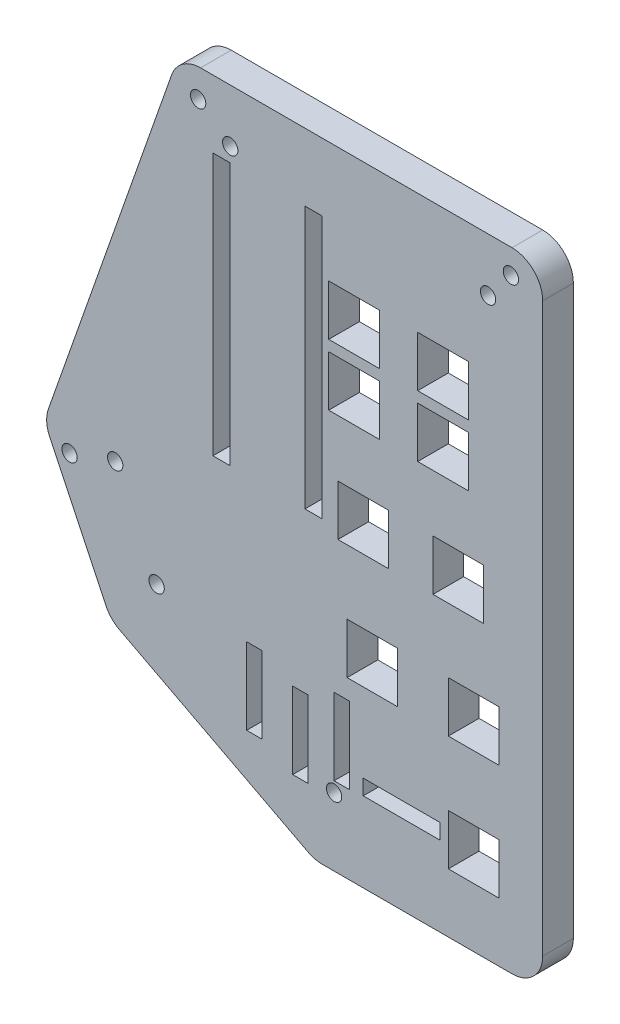
from build123d import *

# Parameters (mm, degrees)
SKETCH1_R           = 1.27
BOSS_EXTRUDE1_DEPTH = 5.08
SKETCH5_W           = 8.382
SKETCH5_H           = 8.382
SKETCH5_W_2         = 2.794
SKETCH5_H_2         = 43.434
CUT_EXTRUDE1_DEPTH  = 112.507157169
SKETCH7_R           = 1.27
CUT_EXTRUDE3_DEPTH  = 112.507157169
SKETCH8_W           = 12.7
SKETCH8_H           = 2.54
SKETCH8_W_2         = 2.54
SKETCH8_H_2         = 12.7
CUT_EXTRUDE4_DEPTH  = 112.507157169


with BuildPart() as part:
    # Sketch1 → Boss-Extrude1 (new body)
    with BuildSketch(Plane.XY):
        with BuildLine():
            Line((-3.314058103, 6.35), (48.26, 6.35))
            ThreePointArc((48.26, 6.35), (51.852102448, 4.862102448), (53.34, 1.27))
            Line((53.34, 1.27), (53.34, -92.71))
            ThreePointArc((53.34, -92.71), (51.852102448, -96.302102448), (48.26, -97.79))
            Line((48.26, -97.79), (16.846989059, -97.79))
            ThreePointArc((16.846989059, -97.79), (15.638688158, -97.644208035), (14.499741809, -97.215200367))
            Line((14.499741809, -97.215200367), (-16.7505185, -80.933552139))
            ThreePointArc((-16.7505185, -80.933552139), (-18.059258376, -79.955412607), (-18.989802686, -78.61241436))
            Line((-18.989802686, -78.61241436), (-28.309569459, -59.040904135))
            ThreePointArc((-28.309569459, -59.040904135), (-28.795802898, -57.127870198), (-28.51617555, -55.173917704))
            Line((-28.51617555, -55.173917704), (-8.107195629, 2.952923842))
            ThreePointArc((-8.107195629, 2.952923842), (-6.251501454, 5.414614163), (-3.314058103, 6.35))
        make_face()
        with Locations((48.0822, 2.286)):
            Circle(SKETCH1_R, mode=Mode.SUBTRACT)
        with Locations((-3.718687848, 1.651)):
            Circle(SKETCH1_R, mode=Mode.SUBTRACT)
        with Locations((-25.012261453, -59.761967182)):
            Circle(SKETCH1_R, mode=Mode.SUBTRACT)
    extrude(amount=BOSS_EXTRUDE1_DEPTH)

    # Sketch5 → Cut-Extrude1 (cut, through all)
    with BuildSketch(Plane(origin=(0, 0, 0), x_dir=(-1, 0, 0), z_dir=(0, 0, -1))):
        with Locations((-36.83, -17.78)):
            Rectangle(SKETCH5_W, SKETCH5_H)
        with Locations((-39.37, -45.72)):
            Rectangle(SKETCH5_W, SKETCH5_H)
        with Locations((-36.83, -27.94)):
            Rectangle(SKETCH5_W, SKETCH5_H)
        with Locations((-41.91, -64.77)):
            Rectangle(SKETCH5_W, SKETCH5_H)
        with Locations((-41.91, -83.82)):
            Rectangle(SKETCH5_W, SKETCH5_H)
        with Locations((-22.098, -17.78)):
            Rectangle(SKETCH5_W, SKETCH5_H)
        with Locations((-22.098, -27.94)):
            Rectangle(SKETCH5_W, SKETCH5_H)
        with Locations((-23.622, -45.72)):
            Rectangle(SKETCH5_W, SKETCH5_H)
        with Locations((-25.146, -64.77)):
            Rectangle(SKETCH5_W, SKETCH5_H)
        with Locations((-15.367, -26.543)):
            Rectangle(SKETCH5_W_2, SKETCH5_H_2)
        with Locations((-0.127, -26.543)):
            Rectangle(SKETCH5_W_2, SKETCH5_H_2)
    extrude(amount=-CUT_EXTRUDE1_DEPTH, mode=Mode.SUBTRACT)

    # Sketch7 → Cut-Extrude3 (cut, through all)
    with BuildSketch(Plane.XY.offset(5.08)):
        with Locations((44.2976, -2.4892)):
            Circle(SKETCH7_R)
        with Locations((1.6002, -2.4384)):
            Circle(SKETCH7_R)
        with Locations((-17.4498, -57.15)):
            Circle(SKETCH7_R)
        with Locations((-10.5918, -71.3486)):
            Circle(SKETCH7_R)
        with Locations((18.796, -86.5378)):
            Circle(SKETCH7_R)
    extrude(amount=-CUT_EXTRUDE3_DEPTH, mode=Mode.SUBTRACT)

    # Sketch8 → Cut-Extrude4 (cut, through all)
    with BuildSketch(Plane.XY.offset(5.08)):
        with Locations((29.972, -83.312)):
            Rectangle(SKETCH8_W, SKETCH8_H)
        with Locations((20.066, -78.486)):
            Rectangle(SKETCH8_W_2, SKETCH8_H_2)
        with Locations((13.208, -81.026)):
            Rectangle(SKETCH8_W_2, SKETCH8_H_2)
        with Locations((5.588, -78.486)):
            Rectangle(SKETCH8_W_2, SKETCH8_H_2)
    extrude(amount=-CUT_EXTRUDE4_DEPTH, mode=Mode.SUBTRACT)


solid = part.part
